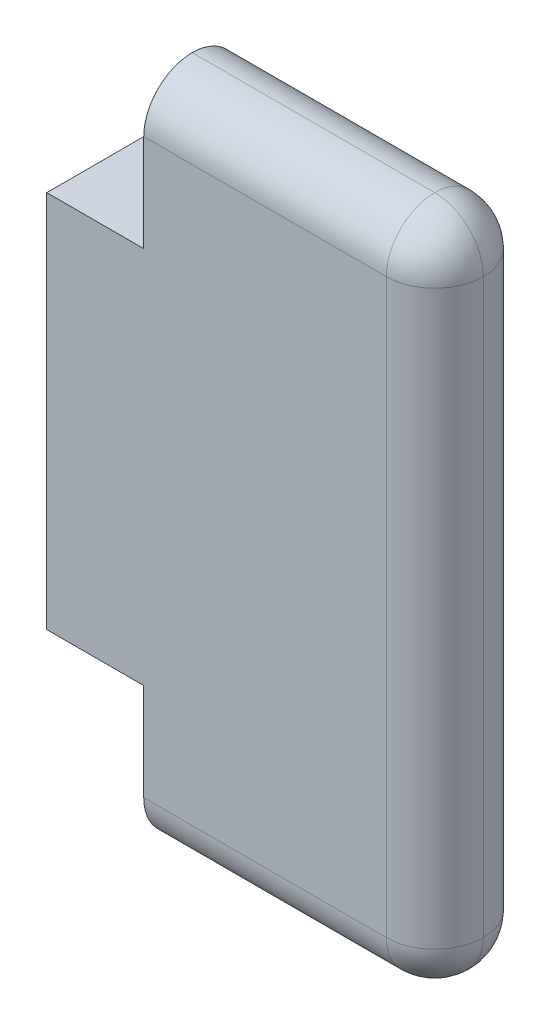
from build123d import *

# Parameters (mm, degrees)
BOSS_EXTRUDE1_DEPTH = 10
FILLET1_R           = 5
FILLET2_R           = 5


# Some blends are built 0.0001 mm under size
with BuildPart() as part:
    # Sketch1 → Boss-Extrude1 (new body)
    with BuildSketch(Plane.XY):
        Polygon((0, -19.5), (0, 19.5), (10, 19.5), (10, 34.5), (40, 34.5), (40, -34.5), (10, -34.5), (10, -19.5), align=None)
    extrude(amount=BOSS_EXTRUDE1_DEPTH)

    # Fillet1
    fillet1_edges = [part.edges().sort_by_distance(p)[0] for p in [
        (40, 0, 10),
        (40, 34.5, 5),
        (40, -34.5, 5),
        (40, 0, 0),
    ]]
    fillet(fillet1_edges, radius=FILLET1_R - 0.0001)  # a hair under: the kernel refuses the full size

    # Fillet2
    # the kernel refuses this fillet: 5 mm, written as the material it takes off along each edge
    with BuildSketch(Plane(origin=(40, 29.5, 5), x_dir=(0, 0, -1), z_dir=(0, -1, 0))) as fillet2_piece_1:
        with BuildLine():
            CenterArc((0.0001, -4.9999), 4.9999, 0, 90)
            Line((5, -4.9999), (5, 0))
            Line((5, 0), (0.0001, 0))
        make_face()
    revolve(axis=Axis((40, 29.5, 5), (1, 0, 0)), revolution_arc=90, mode=Mode.SUBTRACT)
    with BuildSketch(Plane(origin=(40, 29.5, 5), x_dir=(0, 1, 0), z_dir=(0, 0, -1))) as fillet2_piece_2:
        with BuildLine():
            CenterArc((0.0001, -4.9999), 4.9999, 0, 90)
            Line((5, -4.9999), (5, 0))
            Line((5, 0), (0.0001, 0))
        make_face()
    revolve(axis=Axis((40, 29.5, 5), (1, 0, 0)), revolution_arc=90, mode=Mode.SUBTRACT)
    with BuildSketch(Plane(origin=(40, -29.5, 5), x_dir=(0, -1, 0), z_dir=(0, 0, 1))) as fillet2_piece_3:
        with BuildLine():
            CenterArc((0.0001, -4.9999), 4.9999, 0, 90)
            Line((5, -4.9999), (5, 0))
            Line((5, 0), (0.0001, 0))
        make_face()
    revolve(axis=Axis((40, -29.5, 5), (1, 0, 0)), revolution_arc=90, mode=Mode.SUBTRACT)
    with BuildSketch(Plane(origin=(40, -29.5, 5), x_dir=(0, 0, 1), z_dir=(0, 1, 0))) as fillet2_piece_4:
        with BuildLine():
            CenterArc((0.0001, -4.9999), 4.9999, 0, 90)
            Line((5, -4.9999), (5, 0))
            Line((5, 0), (0.0001, 0))
        make_face()
    revolve(axis=Axis((40, -29.5, 5), (1, 0, 0)), revolution_arc=90, mode=Mode.SUBTRACT)
    with BuildSketch(Plane(origin=(-2.5, 34.5, 0), x_dir=(0, 0, 1), z_dir=(1, 0, 0)), Plane(origin=(40, -34.5, 10), x_dir=(0, 1, 0), z_dir=(-1, 0, 0))) as fillet2_piece_5:
        with BuildLine():
            CenterArc((FILLET2_R, FILLET2_R), FILLET2_R, 180, 90)
            Line((0, FILLET2_R), (0, 0))
            Line((0, 0), (FILLET2_R, 0))
        make_face()
    extrude(amount=42.5, mode=Mode.SUBTRACT)
    with BuildSketch(Plane(origin=(-2.5, 34.5, 10), x_dir=(0, 0, -1), z_dir=(1, 0, 0)), Plane(origin=(40, -34.5, 0), x_dir=(0, 1, 0), z_dir=(-1, 0, 0))) as fillet2_piece_6:
        with BuildLine():
            CenterArc((FILLET2_R, -FILLET2_R), FILLET2_R, 90, 90)
            Line((0, -FILLET2_R), (0, 0))
            Line((0, 0), (FILLET2_R, 0))
        make_face()
    extrude(amount=42.5, mode=Mode.SUBTRACT)


solid = part.part
